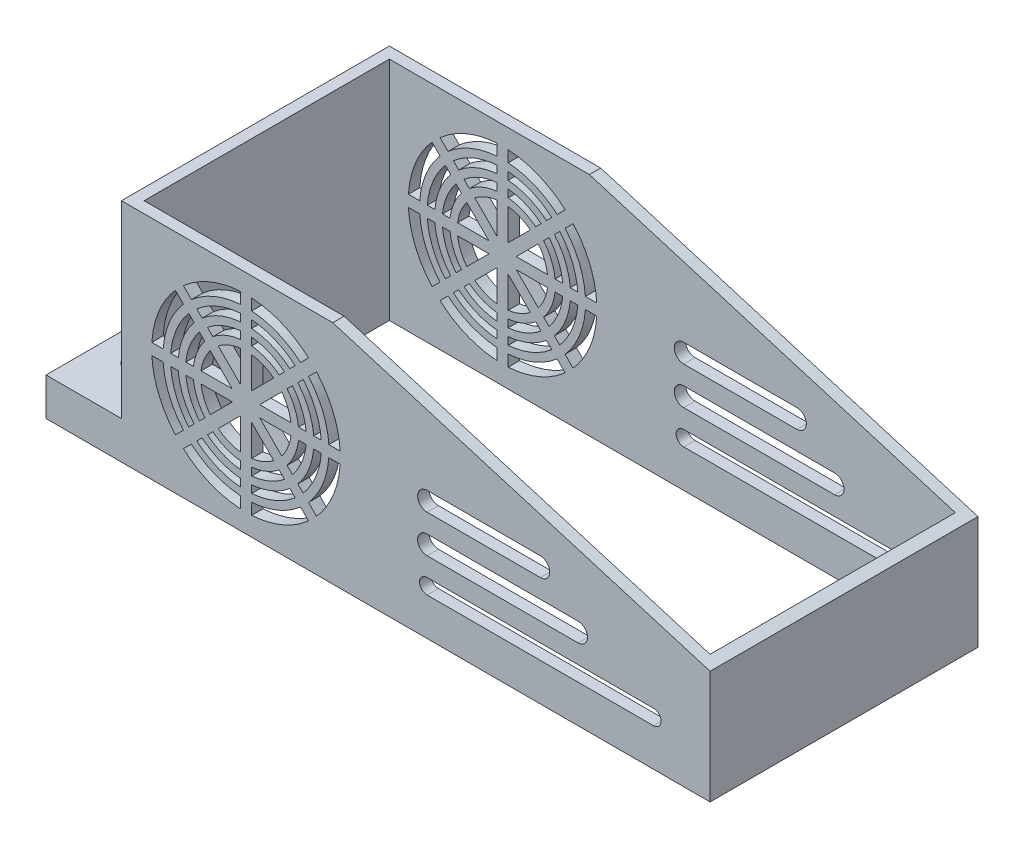
from build123d import *

# Parameters (mm, degrees)
SKETCH3_W           = 156
SKETCH3_H           = 71
BOSS_EXTRUDE1_DEPTH = 87
SKETCH5_W           = 150
SKETCH5_H           = 65
CUT_EXTRUDE1_DEPTH  = 87
SKETCH10_W          = 71
SKETCH10_H          = 10
BOSS_EXTRUDE2_DEPTH = 20
SKETCH11_R          = 4
CUT_EXTRUDE6_DEPTH  = 5
SKETCH13_R          = 2
CUT_EXTRUDE7_DEPTH  = 5
CUT_EXTRUDE8_REACH  = 194.213
SKETCH14_W          = 156
SKETCH14_H          = 27
CUT_EXTRUDE9_REACH  = 183.596
VENT1_DEPTH         = 3
CUT_EXTRUDE11_START = -71
CUT_EXTRUDE11_DEPTH = 71


# Read off the part's stored shape, not the designer's step: Vent1
with BuildPart() as part:
    # Sketch3 → Boss-Extrude1 (new body)
    with BuildSketch(Plane(origin=(0, 0, 0), x_dir=(1, 0, 0), z_dir=(0, 1, 0))):
        with Locations((78, -35.5)):
            Rectangle(SKETCH3_W, SKETCH3_H)
    extrude(amount=BOSS_EXTRUDE1_DEPTH)

    # Sketch5 → Cut-Extrude1 (cut)
    with BuildSketch(Plane(origin=(0, 87, 0), x_dir=(1, 0, 0), z_dir=(0, 1, 0))):
        with Locations((78, -35.5)):
            Rectangle(SKETCH5_W, SKETCH5_H)
    extrude(amount=-CUT_EXTRUDE1_DEPTH, mode=Mode.SUBTRACT)

    # Sketch10 → Boss-Extrude2 (add)
    with BuildSketch(Plane.ZY):
        with Locations((35.5, 5)):
            Rectangle(SKETCH10_W, SKETCH10_H)
    extrude(amount=BOSS_EXTRUDE2_DEPTH)

    # Sketch11 → Cut-Extrude6 (cut)
    with BuildSketch(Plane(origin=(0, 10, 0), x_dir=(1, 0, 0), z_dir=(0, 1, 0))):
        with Locations(Location((-10, -15.5, 0), (0, 0, 270))):
            Circle(SKETCH11_R)
        with Locations(Location((-10, -55.5, 0), (0, 0, 270))):
            Circle(SKETCH11_R)
    extrude(amount=-CUT_EXTRUDE6_DEPTH, mode=Mode.SUBTRACT)

    # Sketch13 → Cut-Extrude7 (cut)
    with BuildSketch(Plane(origin=(0, 5, 0), x_dir=(1, 0, 0), z_dir=(0, 1, 0))):
        with Locations(Location((-10, -15.5, 0), (0, 0, 270))):
            Circle(SKETCH13_R)
    cut_extrude7 = extrude(amount=-CUT_EXTRUDE7_DEPTH, mode=Mode.SUBTRACT)

    # Mirror2: Cut-Extrude7 across plane
    add(cut_extrude7.mirror(Plane.XY.offset(35.5)), mode=Mode.SUBTRACT)

    # Cut-Extrude8: up to this face of the body (flat: up to its plane)
    cut_extrude8_end = Plane(part.part.faces().sort_by_distance((76.722044728, 42.940894569, 0))[0])
    # Sketch14 → Cut-Extrude8 (cut, up to the picked face)
    with BuildSketch(Plane.XY.offset(71), mode=Mode.PRIVATE) as cut_extrude8_sk1:
        with Locations((78, 73.5)):
            Rectangle(SKETCH14_W, SKETCH14_H)
    cut_extrude8_tool1 = split(extrude(cut_extrude8_sk1.sketch, amount=-CUT_EXTRUDE8_REACH, mode=Mode.PRIVATE), bisect_by=cut_extrude8_end, keep=Keep.BOTH, mode=Mode.PRIVATE)
    add(cut_extrude8_tool1.solids().sort_by(Axis((78, 73.5, 71), (0, 0, -1)))[0], mode=Mode.SUBTRACT)

    # Cut-Extrude9: up to this face of the body (flat: up to its plane)
    cut_extrude9_end = Plane(part.part.faces().sort_by_distance((76.158995816, 29.476987448, 0))[0])
    # Sketch15 → Cut-Extrude9 (cut, up to the picked face)
    with BuildSketch(Plane.XY.offset(71), mode=Mode.PRIVATE) as cut_extrude9_sk1:
        Polygon((156, 30), (56, 60), (156, 60), align=None)
    cut_extrude9_tool1 = split(extrude(cut_extrude9_sk1.sketch, amount=-CUT_EXTRUDE9_REACH, mode=Mode.PRIVATE), bisect_by=cut_extrude9_end, keep=Keep.BOTH, mode=Mode.PRIVATE)
    add(cut_extrude9_tool1.solids().sort_by(Axis((122.666667, 50, 71), (0, 0, -1)))[0], mode=Mode.SUBTRACT)

    # Vent1 outline → Vent1 (cut)
    with BuildSketch(Plane.XY):
        with BuildLine():
            add(Edge.make_bspline(
                [(49.585120654, 11.293577234), (48.735098554, 10.540027163), (46.535432739, 8.842285659), (42.628757098, 6.754124024), (38.389767266, 5.468240517), (35.633884396, 5.113326423), (34.499987909, 5.045110378)],
                knots=[0.634555015, 0.634555015, 0.634555015, 0.634555015, 0.65625, 0.6875, 0.71875, 0.74044498, 0.74044498, 0.74044498, 0.74044498], degree=3))
            Line((49.585120654, 11.293577234), (47.459445354, 13.419248241))
            add(Edge.make_bspline(
                [(47.459445354, 13.419248241), (46.751334902, 12.801786914), (44.857899681, 11.352732023), (41.473306247, 9.543629141), (37.800808527, 8.429589138), (35.437311279, 8.115364788), (34.499990658, 8.051266167)],
                knots=[0.635859892, 0.635859892, 0.635859892, 0.635859892, 0.65625, 0.6875, 0.71875, 0.739140104, 0.739140104, 0.739140104, 0.739140104], degree=3))
            Line((34.499990658, 8.051266167), (34.499987909, 5.045110378))
        make_face()
        with BuildLine():
            add(Edge.make_bspline(
                [(16.414879346, 48.706422766), (17.264901446, 49.459972837), (19.464567261, 51.157714341), (23.371242902, 53.245875976), (27.610232734, 54.531759483), (30.366115604, 54.886673577), (31.500012091, 54.954889622)],
                knots=[0.134555015, 0.134555015, 0.134555015, 0.134555015, 0.15625, 0.1875, 0.21875, 0.24044498, 0.24044498, 0.24044498, 0.24044498], degree=3))
            Line((16.414879346, 48.706422766), (18.540554646, 46.580751759))
            add(Edge.make_bspline(
                [(18.540554646, 46.580751759), (19.248665098, 47.198213086), (21.142100319, 48.647267977), (24.526693753, 50.456370859), (28.199191473, 51.570410862), (30.562688721, 51.884635212), (31.500009342, 51.948733833)],
                knots=[0.135859892, 0.135859892, 0.135859892, 0.135859892, 0.15625, 0.1875, 0.21875, 0.239140104, 0.239140104, 0.239140104, 0.239140104], degree=3))
            Line((31.500009342, 51.948733833), (31.500012091, 54.954889622))
        make_face()
        with BuildLine():
            add(Edge.make_bspline(
                [(57.95488967, 28.500012892), (57.886673645, 27.366116135), (57.531759561, 24.610232991), (56.245875976, 20.371242902), (54.157714468, 16.464567498), (52.459973165, 14.26490187), (51.706423298, 13.414879946)],
                knots=[0.509555015, 0.509555015, 0.509555015, 0.509555015, 0.53125, 0.5625, 0.59375, 0.61544498, 0.61544498, 0.61544498, 0.61544498], degree=3))
            Line((57.95488967, 28.500012892), (54.948733868, 28.500009856))
            add(Edge.make_bspline(
                [(54.948733868, 28.500009856), (54.884635257, 27.562689062), (54.570410912, 25.199191638), (53.456370859, 21.526693753), (51.647268058, 18.142100471), (50.198213295, 16.248665371), (49.580752097, 15.540555034)],
                knots=[0.510859892, 0.510859892, 0.510859892, 0.510859892, 0.53125, 0.5625, 0.59375, 0.614140104, 0.614140104, 0.614140104, 0.614140104], degree=3))
            Line((49.580752097, 15.540555034), (51.706423298, 13.414879946))
        make_face()
        with BuildLine():
            add(Edge.make_bspline(
                [(8.045110373, 31.499987823), (8.113326416, 32.633884339), (8.468240509, 35.389767239), (9.754124024, 39.628757098), (11.842285532, 43.535432502), (13.540026835, 45.73509813), (14.293576702, 46.585120054)],
                knots=[0.00955502, 0.00955502, 0.00955502, 0.00955502, 0.03125, 0.0625, 0.09375, 0.11544498, 0.11544498, 0.11544498, 0.11544498], degree=3))
            Line((8.045110373, 31.499987823), (11.05126617, 31.499990693))
            add(Edge.make_bspline(
                [(11.05126617, 31.499990693), (11.115364791, 32.437311303), (11.429589141, 34.800808538), (12.543629141, 38.473306247), (14.352731942, 41.857899529), (15.801786705, 43.751334629), (16.419247903, 44.459444966)],
                knots=[0.010859896, 0.010859896, 0.010859896, 0.010859896, 0.03125, 0.0625, 0.09375, 0.114140104, 0.114140104, 0.114140104, 0.114140104], degree=3))
            Line((16.419247903, 44.459444966), (14.293576702, 46.585120054))
        make_face()
        with BuildLine():
            add(Edge.make_bspline(
                [(51.706422766, 46.585120654), (52.459972837, 45.735098554), (54.157714341, 43.535432739), (56.245875976, 39.628757098), (57.531759483, 35.389767266), (57.886673577, 32.633884396), (57.954889622, 31.499987909)],
                knots=[0.384555015, 0.384555015, 0.384555015, 0.384555015, 0.40625, 0.4375, 0.46875, 0.49044498, 0.49044498, 0.49044498, 0.49044498], degree=3))
            Line((51.706422766, 46.585120654), (49.580751759, 44.459445354))
            add(Edge.make_bspline(
                [(49.580751759, 44.459445354), (50.198213086, 43.751334902), (51.647267977, 41.857899681), (53.456370859, 38.473306247), (54.570410862, 34.800808527), (54.884635212, 32.437311279), (54.948733833, 31.499990658)],
                knots=[0.385859892, 0.385859892, 0.385859892, 0.385859892, 0.40625, 0.4375, 0.46875, 0.489140104, 0.489140104, 0.489140104, 0.489140104], degree=3))
            Line((54.948733833, 31.499990658), (57.954889622, 31.499987909))
        make_face()
        with BuildLine():
            add(Edge.make_bspline(
                [(14.293577234, 13.414879346), (13.540027163, 14.264901446), (11.842285659, 16.464567261), (9.754124024, 20.371242902), (8.468240447, 24.610232963), (8.113326362, 27.366116078), (8.045110335, 28.500012806)],
                knots=[0.884555015, 0.884555015, 0.884555015, 0.884555015, 0.90625, 0.9375, 0.96875, 0.990444984, 0.990444984, 0.990444984, 0.990444984], degree=3))
            Line((14.293577234, 13.414879346), (16.419248241, 15.540554646))
            add(Edge.make_bspline(
                [(16.419248241, 15.540554646), (15.801786914, 16.248665098), (14.352732023, 18.142100319), (12.543629141, 21.526693753), (11.429589084, 25.199191649), (11.11536474, 27.562689085), (11.05126613, 28.500009892)],
                knots=[0.885859892, 0.885859892, 0.885859892, 0.885859892, 0.90625, 0.9375, 0.96875, 0.989140108, 0.989140108, 0.989140108, 0.989140108], degree=3))
            Line((11.05126613, 28.500009892), (8.045110335, 28.500012806))
        make_face()
        with BuildLine():
            add(Edge.make_bspline(
                [(31.500012892, 5.04511033), (30.366116135, 5.113326355), (27.610232991, 5.468240439), (23.371242902, 6.754124024), (19.464567497, 8.842285533), (17.264901868, 10.540026837), (16.414879942, 11.293576706)],
                knots=[0.759555015, 0.759555015, 0.759555015, 0.759555015, 0.78125, 0.8125, 0.84375, 0.86544498, 0.86544498, 0.86544498, 0.86544498], degree=3))
            Line((31.500012892, 5.04511033), (31.500009856, 8.051266132))
            add(Edge.make_bspline(
                [(31.500009856, 8.051266132), (30.562689062, 8.115364743), (28.199191638, 8.429589088), (24.526693753, 9.543629141), (21.142100471, 11.352731942), (19.248665371, 12.801786705), (18.540555034, 13.419247903)],
                knots=[0.760859892, 0.760859892, 0.760859892, 0.760859892, 0.78125, 0.8125, 0.84375, 0.864140104, 0.864140104, 0.864140104, 0.864140104], degree=3))
            Line((18.540555034, 13.419247903), (16.414879942, 11.293576706))
        make_face()
        with BuildLine():
            add(Edge.make_bspline(
                [(34.499987108, 54.95488967), (35.633883865, 54.886673645), (38.389767009, 54.531759561), (42.628757098, 53.245875976), (46.535432503, 51.157714467), (48.735098132, 49.459973163), (49.585120058, 48.706423294)],
                knots=[0.259555015, 0.259555015, 0.259555015, 0.259555015, 0.28125, 0.3125, 0.34375, 0.36544498, 0.36544498, 0.36544498, 0.36544498], degree=3))
            Line((34.499987108, 54.95488967), (34.499990144, 51.948733868))
            add(Edge.make_bspline(
                [(34.499990144, 51.948733868), (35.437310938, 51.884635257), (37.800808362, 51.570410912), (41.473306247, 50.456370859), (44.857899529, 48.647268058), (46.751334629, 47.198213295), (47.459444966, 46.580752097)],
                knots=[0.260859892, 0.260859892, 0.260859892, 0.260859892, 0.28125, 0.3125, 0.34375, 0.364140104, 0.364140104, 0.364140104, 0.364140104], degree=3))
            Line((47.459444966, 46.580752097), (49.585120058, 48.706423294))
        make_face()
        with BuildLine():
            add(Edge.make_bspline(
                [(40.358048005, 20.520645072), (40.133638903, 20.346439994), (39.265567871, 19.720589942), (37.621803407, 18.841979532), (35.838214748, 18.300933827), (34.781852723, 18.12965772), (34.49998964, 18.094158099)],
                knots=[0.644946456, 0.644946456, 0.644946456, 0.644946456, 0.65625, 0.6875, 0.71875, 0.730053556, 0.730053556, 0.730053556, 0.730053556], degree=3))
            Line((40.358048005, 20.520645072), (34.5, 26.378679656))
            Line((34.5, 26.378679656), (34.49998964, 18.094158099))
        make_face()
        with BuildLine():
            Line((43.203184949, 17.675511225), (41.781820299, 19.096875359))
            add(Edge.make_bspline(
                [(41.781820299, 19.096875359), (41.458358562, 18.836338234), (40.384180837, 18.04709672), (38.392103975, 16.982309454), (36.230574532, 16.326616666), (34.912938057, 16.125136338), (34.499988409, 16.080641916)],
                knots=[0.642085037, 0.642085037, 0.642085037, 0.642085037, 0.65625, 0.6875, 0.71875, 0.732914967, 0.732914967, 0.732914967, 0.732914967], degree=3))
            Line((34.499988409, 16.080641916), (34.499988432, 14.070529155))
            add(Edge.make_bspline(
                [(43.203184949, 17.675511225), (42.7822489, 17.327032057), (41.502684113, 16.373544867), (39.162404543, 15.122639376), (36.623053269, 14.352335588), (35.044047111, 14.121763908), (34.499988432, 14.070529155)],
                knots=[0.639942666, 0.639942666, 0.639942666, 0.639942666, 0.65625, 0.6875, 0.71875, 0.735057333, 0.735057333, 0.735057333, 0.735057333], degree=3))
        make_face()
        with BuildLine():
            add(Edge.make_bspline(
                [(31.50000949, 18.094158208), (31.2181467, 18.129657814), (30.161784971, 18.300933912), (28.378196593, 18.841979532), (26.73443187, 19.720590081), (25.866360622, 20.346440336), (25.641951302, 20.520645609)],
                knots=[0.769946456, 0.769946456, 0.769946456, 0.769946456, 0.78125, 0.8125, 0.84375, 0.855053556, 0.855053556, 0.855053556, 0.855053556], degree=3))
            Line((31.50000949, 18.094158208), (31.5, 26.378679656))
            Line((31.5, 26.378679656), (25.641951302, 20.520645609))
        make_face()
        with BuildLine():
            Line((31.50001168, 14.070529145), (31.500011315, 16.080641946))
            add(Edge.make_bspline(
                [(31.500011315, 16.080641946), (31.08706176, 16.125136366), (29.769425379, 16.326616693), (27.607896025, 16.982309454), (25.615819081, 18.047096764), (24.541641289, 18.836338344), (24.218179484, 19.096875533)],
                knots=[0.767085037, 0.767085037, 0.767085037, 0.767085037, 0.78125, 0.8125, 0.84375, 0.857914967, 0.857914967, 0.857914967, 0.857914967], degree=3))
            Line((24.218179484, 19.096875533), (22.796815137, 17.675511153))
            add(Edge.make_bspline(
                [(31.50001168, 14.070529145), (30.955952963, 14.121763898), (29.376946767, 14.352335577), (26.837595457, 15.122639376), (24.49731592, 16.373544849), (23.21775116, 17.327032013), (22.796815137, 17.675511153)],
                knots=[0.764942666, 0.764942666, 0.764942666, 0.764942666, 0.78125, 0.8125, 0.84375, 0.860057333, 0.860057333, 0.860057333, 0.860057333], degree=3))
        make_face()
        with BuildLine():
            add(Edge.make_bspline(
                [(34.49999051, 41.905841792), (34.7818533, 41.870342186), (35.838215029, 41.699066088), (37.621803407, 41.158020468), (39.26556813, 40.279409919), (40.133639378, 39.653559664), (40.358048698, 39.47935439)],
                knots=[0.269946456, 0.269946456, 0.269946456, 0.269946456, 0.28125, 0.3125, 0.34375, 0.355053556, 0.355053556, 0.355053556, 0.355053556], degree=3))
            Line((34.49999051, 41.905841792), (34.5, 33.621320344))
            Line((34.5, 33.621320344), (40.358048698, 39.47935439))
        make_face()
        with BuildLine():
            Line((34.49998832, 45.929470855), (34.499988685, 43.919358054))
            add(Edge.make_bspline(
                [(34.499988685, 43.919358054), (34.912938241, 43.874863634), (36.230574621, 43.673383307), (38.392103975, 43.017690546), (40.384180919, 41.952903236), (41.458358711, 41.163661656), (41.781820516, 40.903124466)],
                knots=[0.267085037, 0.267085037, 0.267085037, 0.267085037, 0.28125, 0.3125, 0.34375, 0.357914967, 0.357914967, 0.357914967, 0.357914967], degree=3))
            Line((41.781820516, 40.903124466), (43.203184863, 42.324488847))
            add(Edge.make_bspline(
                [(34.49998832, 45.929470855), (35.044047037, 45.878236102), (36.623053233, 45.647664423), (39.162404543, 44.877360624), (41.50268408, 43.626455151), (42.78224884, 42.672967987), (43.203184863, 42.324488847)],
                knots=[0.264942666, 0.264942666, 0.264942666, 0.264942666, 0.28125, 0.3125, 0.34375, 0.360057333, 0.360057333, 0.360057333, 0.360057333], degree=3))
        make_face()
        with BuildLine():
            add(Edge.make_bspline(
                [(25.641951995, 39.479354928), (25.866361097, 39.653560006), (26.734432129, 40.279410058), (28.378196593, 41.158020468), (30.161785252, 41.699066173), (31.218147278, 41.87034228), (31.50001036, 41.905841901)],
                knots=[0.144946456, 0.144946456, 0.144946456, 0.144946456, 0.15625, 0.1875, 0.21875, 0.230053556, 0.230053556, 0.230053556, 0.230053556], degree=3))
            Line((25.641951995, 39.479354928), (31.5, 33.621320344))
            Line((31.5, 33.621320344), (31.50001036, 41.905841901))
        make_face()
        with BuildLine():
            Line((22.796815051, 42.324488775), (24.218179701, 40.903124641))
            add(Edge.make_bspline(
                [(24.218179701, 40.903124641), (24.541641438, 41.163661766), (25.615819163, 41.95290328), (27.607896025, 43.017690546), (29.769425468, 43.673383334), (31.087061943, 43.874863662), (31.500011591, 43.919358084)],
                knots=[0.142085037, 0.142085037, 0.142085037, 0.142085037, 0.15625, 0.1875, 0.21875, 0.232914967, 0.232914967, 0.232914967, 0.232914967], degree=3))
            Line((31.500011591, 43.919358084), (31.500011568, 45.929470845))
            add(Edge.make_bspline(
                [(22.796815051, 42.324488775), (23.2177511, 42.672967943), (24.497315887, 43.626455133), (26.837595457, 44.877360624), (29.376946731, 45.647664412), (30.955952889, 45.878236092), (31.500011568, 45.929470845)],
                knots=[0.139942666, 0.139942666, 0.139942666, 0.139942666, 0.15625, 0.1875, 0.21875, 0.235057333, 0.235057333, 0.235057333, 0.235057333], degree=3))
        make_face()
        with BuildLine():
            add(Edge.make_bspline(
                [(21.094158279, 31.499991074), (21.129657875, 31.781853674), (21.300933967, 32.838215211), (21.841979532, 34.621803407), (22.720590081, 36.26556813), (23.346440336, 37.133639378), (23.52064561, 37.358048698)],
                knots=[0.019946463, 0.019946463, 0.019946463, 0.019946463, 0.03125, 0.0625, 0.09375, 0.105053556, 0.105053556, 0.105053556, 0.105053556], degree=3))
            Line((21.094158279, 31.499991074), (29.378679656, 31.5))
            Line((29.378679656, 31.5), (23.52064561, 37.358048698))
        make_face()
        with BuildLine():
            Line((17.070529207, 31.499988983), (19.080642016, 31.499989337))
            add(Edge.make_bspline(
                [(19.080642016, 31.499989337), (19.125136432, 31.912938673), (19.326616756, 33.230574832), (19.982309454, 35.392103975), (21.047096764, 37.384180919), (21.836338344, 38.458358711), (22.096875534, 38.781820516)],
                knots=[0.017085044, 0.017085044, 0.017085044, 0.017085044, 0.03125, 0.0625, 0.09375, 0.107914967, 0.107914967, 0.107914967, 0.107914967], degree=3))
            Line((22.096875534, 38.781820516), (20.675511153, 40.203184863))
            add(Edge.make_bspline(
                [(17.070529207, 31.499988983), (17.121763962, 32.044047477), (17.352335642, 33.623053447), (18.122639376, 36.162404543), (19.373544849, 38.50268408), (20.327032013, 39.78224884), (20.675511153, 40.203184863)],
                knots=[0.014942673, 0.014942673, 0.014942673, 0.014942673, 0.03125, 0.0625, 0.09375, 0.110057333, 0.110057333, 0.110057333, 0.110057333], degree=3))
        make_face()
        with BuildLine():
            add(Edge.make_bspline(
                [(44.905841792, 28.50000949), (44.870342186, 28.2181467), (44.699066088, 27.161784971), (44.158020468, 25.378196593), (43.279409919, 23.73443187), (42.653559664, 22.866360622), (42.479354391, 22.641951302)],
                knots=[0.519946456, 0.519946456, 0.519946456, 0.519946456, 0.53125, 0.5625, 0.59375, 0.605053556, 0.605053556, 0.605053556, 0.605053556], degree=3))
            Line((44.905841792, 28.50000949), (36.621320344, 28.5))
            Line((36.621320344, 28.5), (42.479354391, 22.641951302))
        make_face()
        with BuildLine():
            Line((48.929470855, 28.50001168), (46.919358054, 28.500011315))
            add(Edge.make_bspline(
                [(46.919358054, 28.500011315), (46.874863634, 28.087061759), (46.673383307, 26.769425379), (46.017690546, 24.607896025), (44.952903236, 22.615819081), (44.163661656, 21.541641289), (43.903124467, 21.218179484)],
                knots=[0.517085037, 0.517085037, 0.517085037, 0.517085037, 0.53125, 0.5625, 0.59375, 0.607914967, 0.607914967, 0.607914967, 0.607914967], degree=3))
            Line((43.903124467, 21.218179484), (45.324488847, 19.796815137))
            add(Edge.make_bspline(
                [(48.929470855, 28.50001168), (48.878236102, 27.955952963), (48.647664423, 26.376946767), (47.877360624, 23.837595457), (46.626455151, 21.49731592), (45.672967987, 20.21775116), (45.324488847, 19.796815137)],
                knots=[0.514942666, 0.514942666, 0.514942666, 0.514942666, 0.53125, 0.5625, 0.59375, 0.610057333, 0.610057333, 0.610057333, 0.610057333], degree=3))
        make_face()
        with BuildLine():
            add(Edge.make_bspline(
                [(42.479354928, 37.358048005), (42.653560006, 37.133638903), (43.279410058, 36.265567871), (44.158020468, 34.621803407), (44.699066173, 32.838214748), (44.87034228, 31.781852723), (44.905841901, 31.49998964)],
                knots=[0.394946456, 0.394946456, 0.394946456, 0.394946456, 0.40625, 0.4375, 0.46875, 0.480053556, 0.480053556, 0.480053556, 0.480053556], degree=3))
            Line((42.479354928, 37.358048005), (36.621320344, 31.5))
            Line((36.621320344, 31.5), (44.905841901, 31.49998964))
        make_face()
        with BuildLine():
            Line((45.324488775, 40.203184949), (43.903124641, 38.781820299))
            add(Edge.make_bspline(
                [(43.903124641, 38.781820299), (44.163661766, 38.458358562), (44.95290328, 37.384180837), (46.017690546, 35.392103975), (46.673383334, 33.230574532), (46.874863662, 31.912938057), (46.919358084, 31.499988409)],
                knots=[0.392085037, 0.392085037, 0.392085037, 0.392085037, 0.40625, 0.4375, 0.46875, 0.482914967, 0.482914967, 0.482914967, 0.482914967], degree=3))
            Line((46.919358084, 31.499988409), (48.929470845, 31.499988432))
            add(Edge.make_bspline(
                [(45.324488775, 40.203184949), (45.672967943, 39.7822489), (46.626455133, 38.502684113), (47.877360624, 36.162404543), (48.647664412, 33.623053269), (48.878236092, 32.044047111), (48.929470845, 31.499988432)],
                knots=[0.389942666, 0.389942666, 0.389942666, 0.389942666, 0.40625, 0.4375, 0.46875, 0.485057333, 0.485057333, 0.485057333, 0.485057333], degree=3))
        make_face()
        with BuildLine():
            Line((20.675511225, 19.796815051), (22.096875359, 21.218179701))
            add(Edge.make_bspline(
                [(22.096875359, 21.218179701), (21.836338234, 21.541641438), (21.04709672, 22.615819163), (19.982309454, 24.607896025), (19.326616602, 26.769425678), (19.125136272, 28.087062376), (19.080641846, 28.500012244)],
                knots=[0.892085037, 0.892085037, 0.892085037, 0.892085037, 0.90625, 0.9375, 0.96875, 0.982914974, 0.982914974, 0.982914974, 0.982914974], degree=3))
            Line((19.080641846, 28.500012244), (17.070529093, 28.500012232))
            add(Edge.make_bspline(
                [(20.675511225, 19.796815051), (20.327032057, 20.2177511), (19.373544867, 21.497315887), (18.122639376, 23.837595457), (17.352335523, 26.376946944), (17.121763844, 27.955953329), (17.070529093, 28.500012232)],
                knots=[0.889942666, 0.889942666, 0.889942666, 0.889942666, 0.90625, 0.9375, 0.96875, 0.98505734, 0.98505734, 0.98505734, 0.98505734], degree=3))
        make_face()
        with BuildLine():
            add(Edge.make_bspline(
                [(23.520645077, 22.641951987), (23.346439997, 22.866361092), (22.720589944, 23.734432126), (21.841979532, 25.378196593), (21.300933772, 27.161785434), (21.12965766, 28.218147652), (21.094158028, 28.500010924)],
                knots=[0.894946456, 0.894946456, 0.894946456, 0.894946456, 0.90625, 0.9375, 0.96875, 0.980053563, 0.980053563, 0.980053563, 0.980053563], degree=3))
            Line((23.520645077, 22.641951987), (29.378679656, 28.5))
            Line((29.378679656, 28.5), (21.094158028, 28.500010924))
        make_face()
        with BuildLine():
            Line((46.041603247, 14.837091457), (44.622951707, 16.255743953))
            add(Edge.make_bspline(
                [(44.622951707, 16.255743953), (44.105605785, 15.818266569), (42.621123957, 14.699959109), (39.932705111, 13.262969298), (37.015600782, 12.378075374), (35.175150939, 12.119150993), (34.499989018, 12.062675405)],
                knots=[0.638278276, 0.638278276, 0.638278276, 0.638278276, 0.65625, 0.6875, 0.71875, 0.736721721, 0.736721721, 0.736721721, 0.736721721], degree=3))
            Line((34.499989018, 12.062675405), (34.499989814, 10.056398487))
            add(Edge.make_bspline(
                [(46.041603247, 14.837091457), (45.4285995, 14.309885316), (43.739524588, 13.026352391), (40.703005679, 11.403299219), (37.408190809, 10.403828056), (35.306239805, 10.117066564), (34.499989814, 10.056398487)],
                knots=[0.636947821, 0.636947821, 0.636947821, 0.636947821, 0.65625, 0.6875, 0.71875, 0.738052175, 0.738052175, 0.738052175, 0.738052175], degree=3))
        make_face()
        with BuildLine():
            Line((31.50001064, 10.056398453), (31.500011316, 12.062675377))
            add(Edge.make_bspline(
                [(31.500011316, 12.062675377), (30.824849282, 12.119150962), (28.984399326, 12.378075341), (26.067294889, 13.262969298), (23.378876142, 14.699959056), (21.894394393, 15.818266435), (21.377048549, 16.255743736)],
                knots=[0.763278276, 0.763278276, 0.763278276, 0.763278276, 0.78125, 0.8125, 0.84375, 0.861721721, 0.861721721, 0.861721721, 0.861721721], degree=3))
            Line((21.377048549, 16.255743736), (19.958397098, 14.83709116))
            add(Edge.make_bspline(
                [(31.50001064, 10.056398453), (30.693760496, 10.117066523), (28.591809337, 10.403828011), (25.296994321, 11.403299219), (22.260475547, 13.026352319), (20.571400742, 14.309885132), (19.958397098, 14.83709116)],
                knots=[0.761947821, 0.761947821, 0.761947821, 0.761947821, 0.78125, 0.8125, 0.84375, 0.863052175, 0.863052175, 0.863052175, 0.863052175], degree=3))
        make_face()
        with BuildLine():
            Line((34.49998936, 49.943601547), (34.499988684, 47.937324623))
            add(Edge.make_bspline(
                [(34.499988684, 47.937324623), (35.175150718, 47.880849038), (37.015600674, 47.621924659), (39.932705111, 46.737030702), (42.621123858, 45.300040944), (44.105605607, 44.181733565), (44.622951451, 43.744256264)],
                knots=[0.263278276, 0.263278276, 0.263278276, 0.263278276, 0.28125, 0.3125, 0.34375, 0.361721721, 0.361721721, 0.361721721, 0.361721721], degree=3))
            Line((44.622951451, 43.744256264), (46.041602902, 45.16290884))
            add(Edge.make_bspline(
                [(34.49998936, 49.943601547), (35.306239504, 49.882933477), (37.408190663, 49.596171989), (40.703005679, 48.596700781), (43.739524453, 46.973647681), (45.428599258, 45.690114868), (46.041602902, 45.16290884)],
                knots=[0.261947821, 0.261947821, 0.261947821, 0.261947821, 0.28125, 0.3125, 0.34375, 0.363052175, 0.363052175, 0.363052175, 0.363052175], degree=3))
        make_face()
        with BuildLine():
            Line((19.958396753, 45.162908543), (21.377048293, 43.744256047))
            add(Edge.make_bspline(
                [(21.377048293, 43.744256047), (21.894394215, 44.181733431), (23.378876043, 45.300040891), (26.067294889, 46.737030702), (28.984399218, 47.621924626), (30.824849061, 47.880849007), (31.500010982, 47.937324595)],
                knots=[0.138278276, 0.138278276, 0.138278276, 0.138278276, 0.15625, 0.1875, 0.21875, 0.236721721, 0.236721721, 0.236721721, 0.236721721], degree=3))
            Line((31.500010982, 47.937324595), (31.500010186, 49.943601513))
            add(Edge.make_bspline(
                [(19.958396753, 45.162908543), (20.5714005, 45.690114684), (22.260475412, 46.973647609), (25.296994321, 48.596700781), (28.591809191, 49.596171944), (30.693760195, 49.882933436), (31.500010186, 49.943601513)],
                knots=[0.136947821, 0.136947821, 0.136947821, 0.136947821, 0.15625, 0.1875, 0.21875, 0.238052175, 0.238052175, 0.238052175, 0.238052175], degree=3))
        make_face()
        with BuildLine():
            Line((13.056398498, 31.499989955), (15.06267543, 31.499989321))
            add(Edge.make_bspline(
                [(15.06267543, 31.499989321), (15.119151022, 32.175151141), (15.378075403, 34.015600879), (16.262969298, 36.932705111), (17.699959056, 39.621123858), (18.818266435, 41.105605607), (19.255743736, 41.622951451)],
                knots=[0.013278282, 0.013278282, 0.013278282, 0.013278282, 0.03125, 0.0625, 0.09375, 0.111721721, 0.111721721, 0.111721721, 0.111721721], degree=3))
            Line((19.255743736, 41.622951451), (17.83709116, 43.041602902))
            add(Edge.make_bspline(
                [(13.056398498, 31.499989955), (13.117066576, 32.306239898), (13.403828069, 34.408190854), (14.403299219, 37.703005679), (16.026352319, 40.739524453), (17.309885132, 42.428599258), (17.83709116, 43.041602902)],
                knots=[0.011947826, 0.011947826, 0.011947826, 0.011947826, 0.03125, 0.0625, 0.09375, 0.113052175, 0.113052175, 0.113052175, 0.113052175], degree=3))
        make_face()
        with BuildLine():
            Line((52.943601547, 28.50001064), (50.937324623, 28.500011316))
            add(Edge.make_bspline(
                [(50.937324623, 28.500011316), (50.880849038, 27.824849282), (50.621924659, 25.984399326), (49.737030702, 23.067294889), (48.300040944, 20.378876142), (47.181733565, 18.894394393), (46.744256264, 18.377048549)],
                knots=[0.513278276, 0.513278276, 0.513278276, 0.513278276, 0.53125, 0.5625, 0.59375, 0.611721721, 0.611721721, 0.611721721, 0.611721721], degree=3))
            Line((46.744256264, 18.377048549), (48.16290884, 16.958397098))
            add(Edge.make_bspline(
                [(52.943601547, 28.50001064), (52.882933477, 27.693760496), (52.596171989, 25.591809337), (51.596700781, 22.296994321), (49.973647681, 19.260475547), (48.690114868, 17.571400742), (48.16290884, 16.958397098)],
                knots=[0.511947821, 0.511947821, 0.511947821, 0.511947821, 0.53125, 0.5625, 0.59375, 0.613052175, 0.613052175, 0.613052175, 0.613052175], degree=3))
        make_face()
        with BuildLine():
            Line((48.162908543, 43.041603247), (46.744256047, 41.622951707))
            add(Edge.make_bspline(
                [(46.744256047, 41.622951707), (47.181733431, 41.105605785), (48.300040891, 39.621123957), (49.737030702, 36.932705111), (50.621924626, 34.015600782), (50.880849007, 32.175150939), (50.937324595, 31.499989018)],
                knots=[0.388278276, 0.388278276, 0.388278276, 0.388278276, 0.40625, 0.4375, 0.46875, 0.486721721, 0.486721721, 0.486721721, 0.486721721], degree=3))
            Line((50.937324595, 31.499989018), (52.943601513, 31.499989814))
            add(Edge.make_bspline(
                [(48.162908543, 43.041603247), (48.690114684, 42.4285995), (49.973647609, 40.739524588), (51.596700781, 37.703005679), (52.596171944, 34.408190809), (52.882933436, 32.306239805), (52.943601513, 31.499989814)],
                knots=[0.386947821, 0.386947821, 0.386947821, 0.386947821, 0.40625, 0.4375, 0.46875, 0.488052175, 0.488052175, 0.488052175, 0.488052175], degree=3))
        make_face()
        with BuildLine():
            Line((17.837091457, 16.958396753), (19.255743953, 18.377048293))
            add(Edge.make_bspline(
                [(19.255743953, 18.377048293), (18.818266569, 18.894394215), (17.699959109, 20.378876043), (16.262969298, 23.067294889), (15.378075311, 25.984399424), (15.119150934, 27.824849484), (15.062675352, 28.50001162)],
                knots=[0.888278276, 0.888278276, 0.888278276, 0.888278276, 0.90625, 0.9375, 0.96875, 0.986721726, 0.986721726, 0.986721726, 0.986721726], degree=3))
            Line((15.062675352, 28.50001162), (13.056398443, 28.500010781))
            add(Edge.make_bspline(
                [(17.837091457, 16.958396753), (17.309885316, 17.5714005), (16.026352391, 19.260475412), (14.403299219, 22.296994321), (13.403827998, 25.591809382), (13.11706651, 27.69376059), (13.056398443, 28.500010781)],
                knots=[0.886947821, 0.886947821, 0.886947821, 0.886947821, 0.90625, 0.9375, 0.96875, 0.98805218, 0.98805218, 0.98805218, 0.98805218], degree=3))
        make_face()
    vent1 = extrude(amount=VENT1_DEPTH, mode=Mode.SUBTRACT)

    # Mirror3: Vent1 across plane
    add(vent1.mirror(Plane.XY.offset(35.5)), mode=Mode.SUBTRACT)

    # Sketch23 → Cut-Extrude11 (cut)
    with BuildSketch(Plane(origin=(0, 0, 0), x_dir=(-1, 0, 0), z_dir=(0, 0, -1)).offset(CUT_EXTRUDE11_START)):
        with BuildLine():
            Line((-141, 14.009727922), (-81, 14.009727922))
            ThreePointArc((-81, 14.009727922), (-78.995136039, 12.004863961), (-81, 10))
            Line((-81, 10), (-141, 10))
            ThreePointArc((-141, 10), (-143.004863961, 12.004863961), (-141, 14.009727922))
        make_face()
        with BuildLine():
            Line((-121, 24.009727922), (-81, 24.009727922))
            ThreePointArc((-81, 24.009727922), (-78.5, 21.509727922), (-81, 19.009727922))
            Line((-81, 19.009727922), (-121, 19.009727922))
            ThreePointArc((-121, 19.009727922), (-123.5, 21.509727922), (-121, 24.009727922))
        make_face()
        with BuildLine():
            Line((-111, 34.009727922), (-81, 34.009727922))
            ThreePointArc((-81, 34.009727922), (-78.5, 31.509727922), (-81, 29.009727922))
            Line((-81, 29.009727922), (-111, 29.009727922))
            ThreePointArc((-111, 29.009727922), (-113.5, 31.509727922), (-111, 34.009727922))
        make_face()
    extrude(amount=CUT_EXTRUDE11_DEPTH, mode=Mode.SUBTRACT)


solid = part.part
